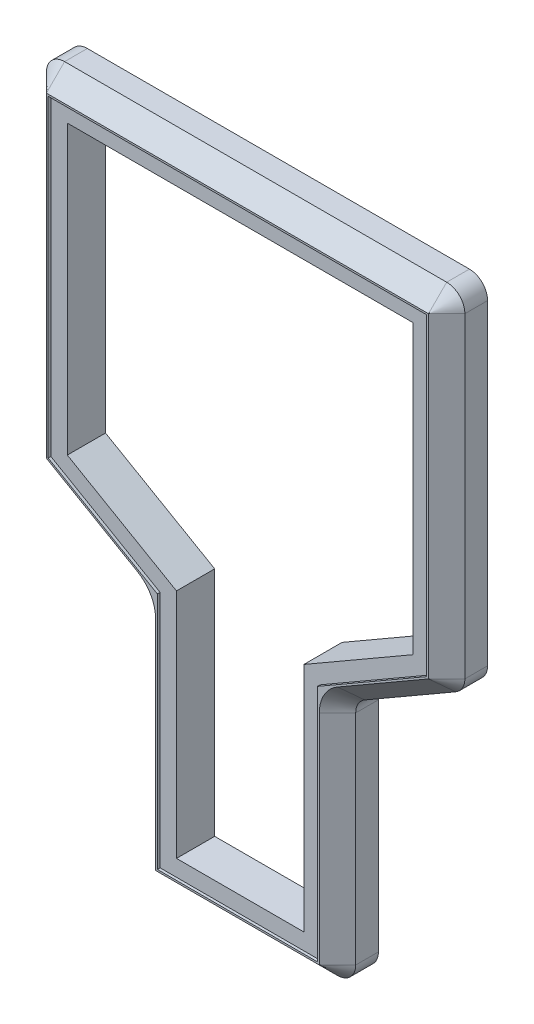
from build123d import *

# Parameters (mm, degrees)
RESSALTO_EXTRUS_O1_DEPTH = 22.5
CHANFRO1_SIZE            = 10
CORTE_EXTRUS_O1_REACH    = 380.591
ESBO_O3_W                = 1139.230904301
ESBO_O3_H                = 709.798033895
CORTE_EXTRUS_O5_DEPTH    = 1.5


with BuildPart() as part:
    # Esboço1 → Ressalto-extrusão1 (new, symmetric)
    with BuildSketch(Plane.XY):
        with BuildLine():
            Line((-45, 0), (45, 0))
            ThreePointArc((45, 0), (52.071067812, 2.928932188), (55, 10))
            Line((55, 10), (55, 130))
            ThreePointArc((55, 130), (56.339745962, 135), (60, 138.660254038))
            Line((60, 138.660254038), (110, 167.527767497))
            ThreePointArc((110, 167.527767497), (113.660254038, 171.188021535), (115, 176.188021535))
            Line((115, 176.188021535), (115, 350))
            ThreePointArc((115, 350), (112.071067812, 357.071067812), (105, 360))
            Line((105, 360), (-105, 360))
            ThreePointArc((-105, 360), (-112.071067812, 357.071067812), (-115, 350))
            Line((-115, 350), (-115, 176.188021535))
            ThreePointArc((-115, 176.188021535), (-113.660254038, 171.188021535), (-110, 167.527767497))
            Line((-110, 167.527767497), (-60, 138.660254038))
            ThreePointArc((-60, 138.660254038), (-56.339745962, 135), (-55, 130))
            Line((-55, 130), (-55, 10))
            ThreePointArc((-55, 10), (-52.071067812, 2.928932188), (-45, 0))
        make_face()
        Polygon((-35, 20), (35, 20), (35, 147.320508076), (95, 181.961524227), (95, 340), (-95, 340), (-95, 181.961524227), (-35, 147.320508076), align=None, mode=Mode.SUBTRACT)
    extrude(amount=RESSALTO_EXTRUS_O1_DEPTH, both=True)

    # Chanfro1
    chanfro1_edges = [part.edges().sort_by_distance(p)[0] for p in [
        (113.660254038, 171.188021535, 22.5),
        (115, 263.094010768, 22.5),
        (115, 263.094010768, -22.5),
        (113.660254038, 171.188021535, -22.5),
        (85, 153.094010768, -22.5),
        (56.339745962, 135, -22.5),
        (55, 70, -22.5),
        (52.071067812, 2.928932188, -22.5),
        (0, 0, -22.5),
        (-52.071067812, 2.928932188, -22.5),
        (-55, 70, -22.5),
        (-56.339745962, 135, -22.5),
        (-85, 153.094010768, -22.5),
        (-113.660254038, 171.188021535, -22.5),
        (-115, 263.094010768, -22.5),
        (-112.071067812, 357.071067812, -22.5),
        (0, 360, -22.5),
        (112.071067812, 357.071067812, -22.5),
        (112.071067812, 357.071067812, 22.5),
        (0, 360, 22.5),
        (-112.071067812, 357.071067812, 22.5),
        (-115, 263.094010768, 22.5),
        (-113.660254038, 171.188021535, 22.5),
        (-85, 153.094010768, 22.5),
        (-56.339745962, 135, 22.5),
        (-55, 70, 22.5),
        (-52.071067812, 2.928932188, 22.5),
        (0, 0, 22.5),
        (52.071067812, 2.928932188, 22.5),
        (55, 70, 22.5),
        (56.339745962, 135, 22.5),
        (85, 153.094010768, 22.5),
    ]]
    chamfer(chanfro1_edges, length=CHANFRO1_SIZE - 0.0001)  # a hair under: the kernel refuses the full size

    # Esboço3 → Corte-extrusão1 (cut, up to next)
    with BuildSketch(Plane.XY, mode=Mode.PRIVATE) as corte_extrus_o1_sk1:
        with Locations((-153.157436203, 152.53565808)):
            Rectangle(ESBO_O3_W, ESBO_O3_H)
    corte_extrus_o1_tool1 = extrude(corte_extrus_o1_sk1.sketch, amount=-CORTE_EXTRUS_O1_REACH, mode=Mode.PRIVATE) & part.part
    add(corte_extrus_o1_tool1.solids().sort_by_distance((-153.157436, 152.535658, 0))[0], mode=Mode.SUBTRACT)

    # Esboço4 → Corte-extrusão5 (cut)
    with BuildSketch(Plane.XY.offset(22.5)):
        Polygon((104, 349), (-104, 349), (-104, 176.765371804), (-44, 142.124355653), (-44, 11), (44, 11), (44, 142.124355653), (104, 176.765371804), align=None)
        Polygon((-95, 340), (-95, 181.961524227), (-35, 147.320508076), (-35, 20), (0, 20), (35, 20), (35, 147.320508076), (95, 181.961524227), (95, 340), align=None, mode=Mode.SUBTRACT)
    extrude(amount=-CORTE_EXTRUS_O5_DEPTH, mode=Mode.SUBTRACT)


solid = part.part
